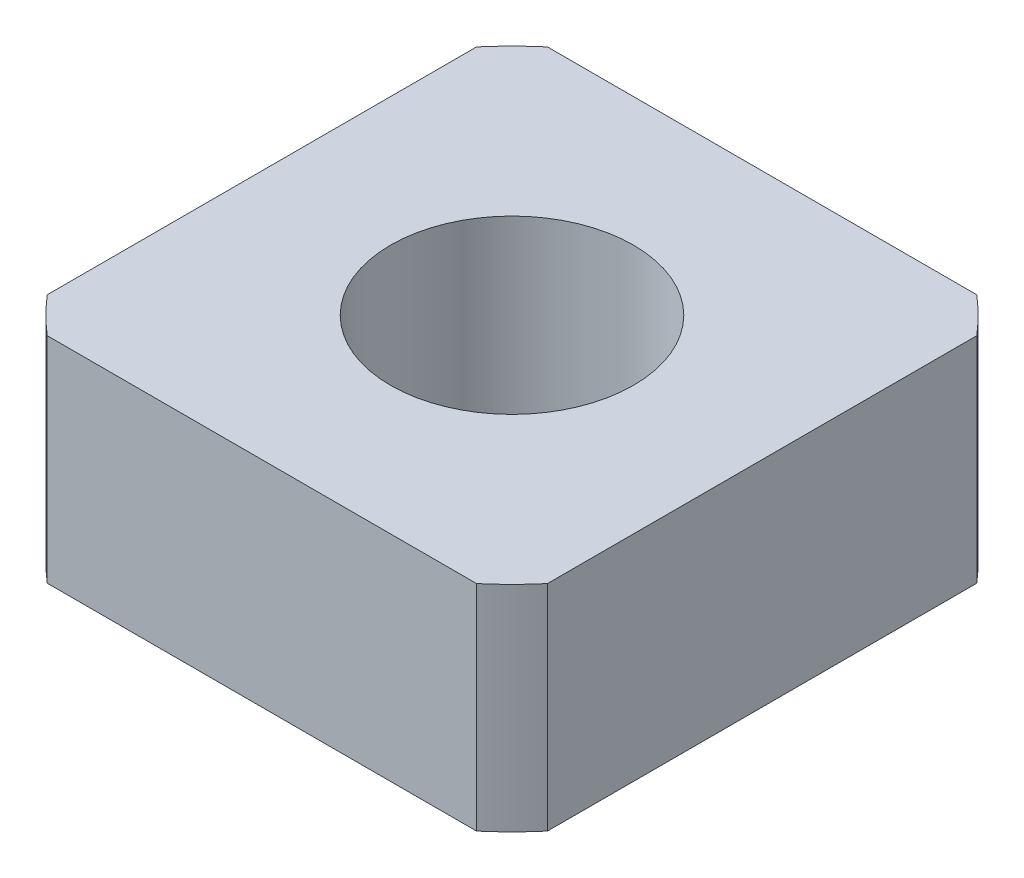
from build123d import *

# Parameters (mm, degrees)
SKETCH1_R           = 1.7
BOSS_EXTRUDE1_DEPTH = 3


with BuildPart() as part:
    # Sketch1 → Boss-Extrude1 (new body)
    with BuildSketch(Plane(origin=(0, 0, 0), x_dir=(1, 0, 0), z_dir=(0, 1, 0))):
        with BuildLine():
            Line((3.5, -3.004547628), (3.5, 3.004547628))
            ThreePointArc((3.5, 3.004547628), (3.261694839, 3.261694839), (3.004547628, 3.5))
            Line((3.004547628, 3.5), (-3.004547628, 3.5))
            ThreePointArc((-3.004547628, 3.5), (-3.261694839, 3.261694839), (-3.5, 3.004547628))
            Line((-3.5, 3.004547628), (-3.5, -3.004547628))
            ThreePointArc((-3.5, -3.004547628), (-3.261694839, -3.261694839), (-3.004547628, -3.5))
            Line((-3.004547628, -3.5), (3.004547628, -3.5))
            ThreePointArc((3.004547628, -3.5), (3.261694839, -3.261694839), (3.5, -3.004547628))
        make_face()
        Circle(SKETCH1_R, mode=Mode.SUBTRACT)
    extrude(amount=BOSS_EXTRUDE1_DEPTH)


solid = part.part
